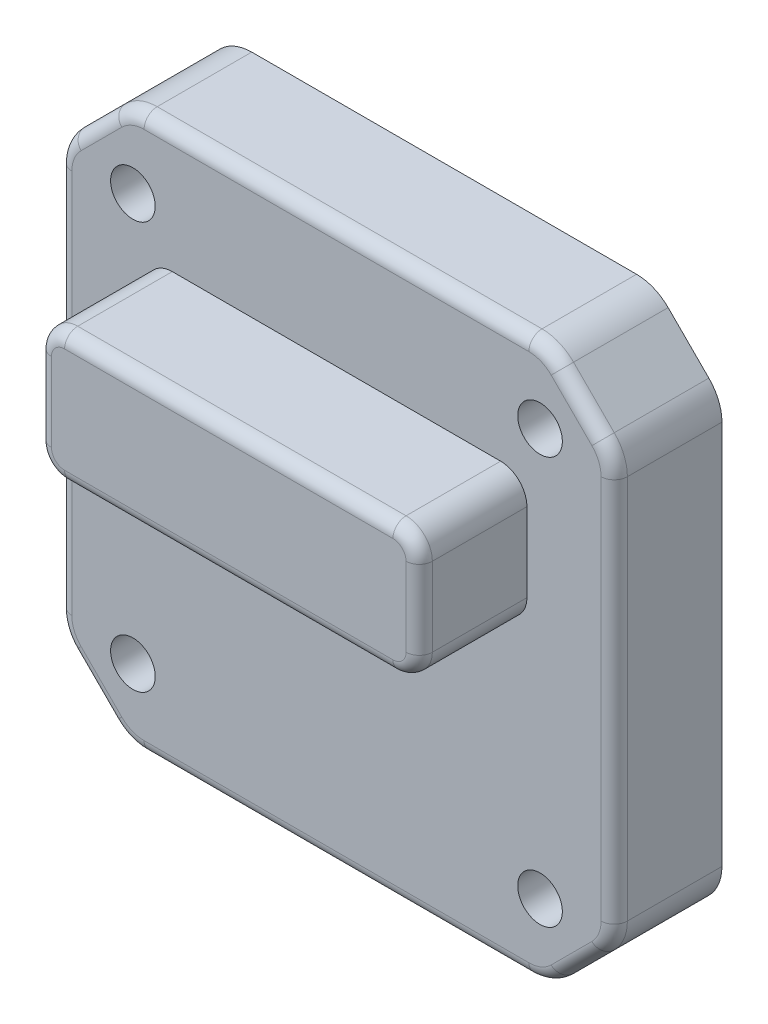
from build123d import *

# Parameters (mm, degrees)
SKETCH1_R           = 1.7
BOSS_EXTRUDE1_DEPTH = 8.2
SKETCH2_W           = 29
SKETCH2_H           = 10
BOSS_EXTRUDE2_DEPTH = 8.2
FILLET2_R           = 1
FILLET3_R           = 2


with BuildPart() as part:
    # Sketch1 → Boss-Extrude1 (new body)
    with BuildSketch(Plane.XY):
        with BuildLine():
            Line((-21.15, 14.65), (-21.15, -14.65))
            ThreePointArc((-21.15, -14.65), (-20.891190411, -15.95112367), (-20.154163056, -17.054163056))
            Line((-20.154163056, -17.054163056), (-17.054163056, -20.154163056))
            ThreePointArc((-17.054163056, -20.154163056), (-15.95112367, -20.891190411), (-14.65, -21.15))
            Line((-14.65, -21.15), (14.65, -21.15))
            ThreePointArc((14.65, -21.15), (15.95112367, -20.891190411), (17.054163056, -20.154163056))
            Line((17.054163056, -20.154163056), (20.154163056, -17.054163056))
            ThreePointArc((20.154163056, -17.054163056), (20.891190411, -15.95112367), (21.15, -14.65))
            Line((21.15, -14.65), (21.15, 14.65))
            ThreePointArc((21.15, 14.65), (20.891190411, 15.95112367), (20.154163056, 17.054163056))
            Line((20.154163056, 17.054163056), (17.054163056, 20.154163056))
            ThreePointArc((17.054163056, 20.154163056), (15.95112367, 20.891190411), (14.65, 21.15))
            Line((14.65, 21.15), (-14.65, 21.15))
            ThreePointArc((-14.65, 21.15), (-15.95112367, 20.891190411), (-17.054163056, 20.154163056))
            Line((-17.054163056, 20.154163056), (-20.154163056, 17.054163056))
            ThreePointArc((-20.154163056, 17.054163056), (-20.891190411, 15.95112367), (-21.15, 14.65))
        make_face()
        with Locations((-15.5, 15.5)):
            Circle(SKETCH1_R, mode=Mode.SUBTRACT)
        with Locations((15.5, 15.5)):
            Circle(SKETCH1_R, mode=Mode.SUBTRACT)
        with Locations((15.5, -15.5)):
            Circle(SKETCH1_R, mode=Mode.SUBTRACT)
        with Locations((-15.5, -15.5)):
            Circle(SKETCH1_R, mode=Mode.SUBTRACT)
    extrude(amount=BOSS_EXTRUDE1_DEPTH)

    # Sketch2 → Boss-Extrude2 (add)
    with BuildSketch(Plane.XY.offset(8.2)):
        with Locations((0, 6.849045043)):
            Rectangle(SKETCH2_W, SKETCH2_H)
    extrude(amount=BOSS_EXTRUDE2_DEPTH)

    # Fillet2
    fillet2_edges = [part.edges().sort_by_distance(p)[0] for p in [
        (15.95112367, 20.891190411, 8.2),
        (0, 21.15, 8.2),
        (-15.95112367, 20.891190411, 8.2),
        (-18.604163056, 18.604163056, 8.2),
        (-20.891190411, 15.95112367, 8.2),
        (-21.15, 0, 8.2),
        (-20.891190411, -15.95112367, 8.2),
        (-18.604163056, -18.604163056, 8.2),
        (-15.95112367, -20.891190411, 8.2),
        (0, -21.15, 8.2),
        (20.891190411, 15.95112367, 8.2),
        (15.95112367, -20.891190411, 8.2),
        (18.604163056, -18.604163056, 8.2),
        (20.891190411, -15.95112367, 8.2),
        (21.15, 0, 8.2),
        (-14.5, 6.849045043, 16.4),
        (0, 1.849045043, 16.4),
        (14.5, 6.849045043, 16.4),
        (0, 11.849045043, 16.4),
        (18.604163056, 18.604163056, 8.2),
    ]]
    fillet(fillet2_edges, radius=FILLET2_R)

    # Fillet3
    # the kernel refuses this fillet: 2 mm, written as the material it takes off along each edge
    with BuildSketch(Plane(origin=(12.5, 3.849045043, 16.4), x_dir=(0, -1, 0), z_dir=(-1, 0, 0))) as fillet3_piece_1:
        with BuildLine():
            CenterArc((1, -1), 1, 0, 90)
            Line((2, -1), (2, 0))
            Line((2, 0), (1, 0))
        make_face()
    revolve(axis=Axis((12.5, 3.849045043, 16.4), (0, 0, 1)), revolution_arc=90, mode=Mode.SUBTRACT)
    with BuildSketch(Plane(origin=(-12.5, 3.849045043, 16.4), x_dir=(-1, 0, 0), z_dir=(0, 1, 0))) as fillet3_piece_2:
        with BuildLine():
            CenterArc((1, -1), 1, 0, 90)
            Line((2, -1), (2, 0))
            Line((2, 0), (1, 0))
        make_face()
    revolve(axis=Axis((-12.5, 3.849045043, 16.4), (0, 0, 1)), revolution_arc=90, mode=Mode.SUBTRACT)
    with BuildSketch(Plane(origin=(12.5, 9.849045043, 16.4), x_dir=(1, 0, 0), z_dir=(0, -1, 0))) as fillet3_piece_3:
        with BuildLine():
            CenterArc((1, -1), 1, 0, 90)
            Line((2, -1), (2, 0))
            Line((2, 0), (1, 0))
        make_face()
    revolve(axis=Axis((12.5, 9.849045043, 16.4), (0, 0, 1)), revolution_arc=90, mode=Mode.SUBTRACT)
    with BuildSketch(Plane(origin=(-12.5, 9.849045043, 16.4), x_dir=(0, 1, 0), z_dir=(1, 0, 0))) as fillet3_piece_4:
        with BuildLine():
            CenterArc((1, -1), 1, 0, 90)
            Line((2, -1), (2, 0))
            Line((2, 0), (1, 0))
        make_face()
    revolve(axis=Axis((-12.5, 9.849045043, 16.4), (0, 0, 1)), revolution_arc=90, mode=Mode.SUBTRACT)
    with BuildSketch(Plane(origin=(-14.5, 11.849045043, 8.2), x_dir=(0, -1, 0), z_dir=(0, 0, 1))) as fillet3_piece_5:
        with BuildLine():
            CenterArc((FILLET3_R, FILLET3_R), FILLET3_R, 180, 90)
            Line((0, FILLET3_R), (0, 0))
            Line((0, 0), (FILLET3_R, 0))
        make_face()
    extrude(amount=8.2, mode=Mode.SUBTRACT)
    with BuildSketch(Plane(origin=(14.5, 11.849045043, 8.2), x_dir=(0, -1, 0), z_dir=(0, 0, 1)), Plane(origin=(14.5, 1.849045043, 8.2), x_dir=(-1, 0, 0), z_dir=(0, 0, 1)), Plane(origin=(-14.5, 1.849045043, 8.2), x_dir=(0, 1, 0), z_dir=(0, 0, 1))) as fillet3_piece_6:
        with BuildLine():
            CenterArc((FILLET3_R, -FILLET3_R), FILLET3_R, 90, 90)
            Line((0, -FILLET3_R), (0, 0))
            Line((0, 0), (FILLET3_R, 0))
        make_face()
    extrude(amount=8.2, mode=Mode.SUBTRACT)


solid = part.part
